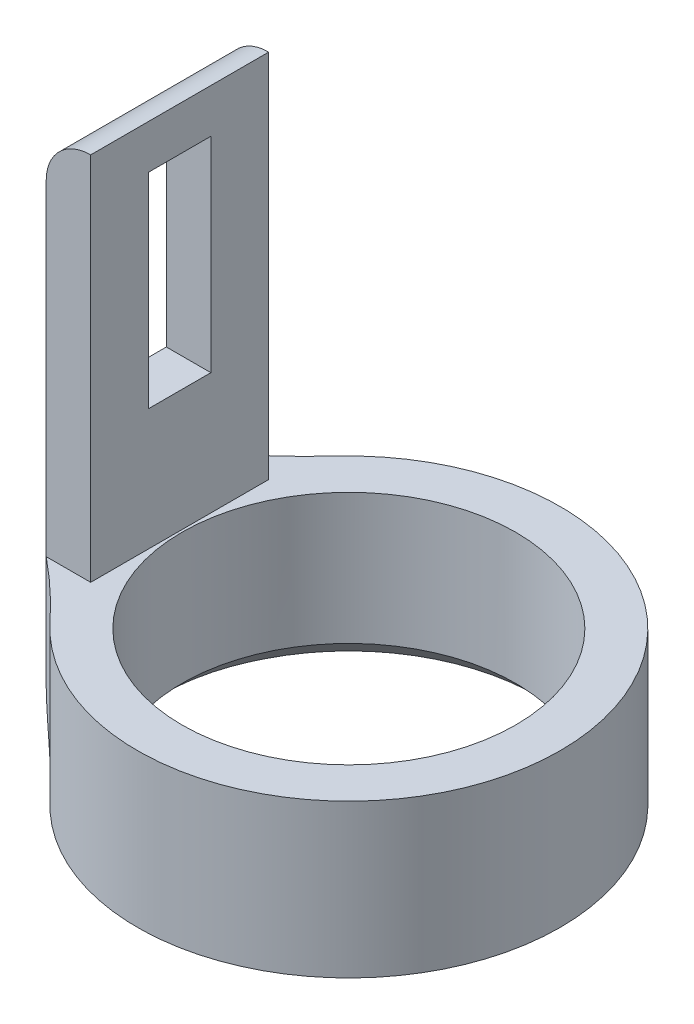
from build123d import *

# Parameters (mm, degrees)
SKETCH2_R           = 4.75
SKETCH2_R_2         = 3.75
BOSS_EXTRUDE1_DEPTH = 3.44
SKETCH3_W           = 4
SKETCH3_H           = 11.757601451
BOSS_EXTRUDE2_DEPTH = 1
SKETCH4_W           = 1.4
SKETCH4_H           = 4.6
CUT_EXTRUDE1_DEPTH  = 1
FILLET1_R           = 13
CHAMFER1_SIZE       = 0.5
FILLET2_R           = 1


with BuildPart() as part:
    # Sketch2 → Boss-Extrude1 (new body)
    with BuildSketch(Plane(origin=(0, 0, 0), x_dir=(1, 0, 0), z_dir=(0, 1, 0))):
        with Locations(Location((0, 0, 0), (0, 0, 270))):
            Circle(SKETCH2_R)
        with Locations(Location((0, 0, 0), (0, 0, 270))):
            Circle(SKETCH2_R_2, mode=Mode.SUBTRACT)
    extrude(amount=BOSS_EXTRUDE1_DEPTH)

    # Sketch3 → Boss-Extrude2 (add)
    with BuildSketch(Plane(origin=(-4.8, 0, 0), x_dir=(0, 0, -1), z_dir=(1, 0, 0))):
        with Locations((0, 5.878800726)):
            Rectangle(SKETCH3_W, SKETCH3_H)
    extrude(amount=BOSS_EXTRUDE2_DEPTH)

    # Sketch4 → Cut-Extrude1 (cut)
    with BuildSketch(Plane.ZY.offset(4.8)):
        with Locations((0, 8.46916965)):
            Rectangle(SKETCH4_W, SKETCH4_H)
    extrude(amount=-CUT_EXTRUDE1_DEPTH, mode=Mode.SUBTRACT)

    # Fillet1
    # the kernel refuses this fillet: 13 mm, written as the material it adds along each edge
    with BuildSketch(Plane(origin=(-4.308421985, 3.44, 2), x_dir=(0.5581025465687688, 0, 0.8297719852546573), z_dir=(0, -1, 0))) as fillet1_piece_1:
        with BuildLine():
            CenterArc((3.528934631, 12.839109145), FILLET1_R, 252.988692503, 7.987692365)
            Line((-0.274350942, 0.407897665), (-0.350416654, 0.159273436))
            ThreePointArc((-0.350416654, 0.159273436), (-0.352916187, 0.058842171), (-0.215740716, -0.145106662))
            Line((-0.215740716, -0.145106662), (0.0407788, -0.256782183))
            ThreePointArc((0.0407788, -0.256782183), (0.744997311, -0.201212957), (1.449215822, -0.256782183))
            Line((1.449215822, -0.256782183), (1.489994622, 0))
        make_face()
    extrude(amount=3.44)
    with BuildSketch(Plane(origin=(-4.308421985, 3.44, -2), x_dir=(0.5581025465687675, 0, -0.8297719852546583), z_dir=(0, -1, 0))) as fillet1_piece_2:
        with BuildLine():
            CenterArc((3.528934631, -12.839109145), FILLET1_R, 99.023615132, 7.987692365)
            Line((-0.274350942, -0.407897665), (-0.350416654, -0.159273436))
            ThreePointArc((-0.350416654, -0.159273436), (-0.352916187, -0.058842171), (-0.215740716, 0.145106662))
            Line((-0.215740716, 0.145106662), (0.0407788, 0.256782183))
            ThreePointArc((0.0407788, 0.256782183), (0.744997311, 0.201212957), (1.449215822, 0.256782183))
            Line((1.449215822, 0.256782183), (1.489994622, 0))
        make_face()
    extrude(amount=3.44)

    # Chamfer1
    chamfer1_edges = [part.edges().sort_by_distance(p)[0] for p in [
        (0, 0, -3.75),
    ]]
    chamfer(chamfer1_edges, length=CHAMFER1_SIZE)

    # Fillet2
    # the kernel refuses this fillet: 1 mm, written as the material it takes off along each edge
    with BuildSketch(Plane(origin=(-4.8, 0, 4.5), x_dir=(1, 0, 0), z_dir=(0, 0, -1))) as fillet2_piece_1:
        with BuildLine():
            CenterArc((FILLET2_R, -FILLET2_R), FILLET2_R, 90, 90)
            Line((0, -FILLET2_R), (0, 0))
            Line((0, 0), (FILLET2_R, 0))
        make_face()
    extrude(amount=9, mode=Mode.SUBTRACT)
    with BuildSketch(Plane(origin=(-4.8, 11.757601451, -4.5), x_dir=(0, -1, 0), z_dir=(0, 0, 1))) as fillet2_piece_2:
        with BuildLine():
            CenterArc((FILLET2_R, FILLET2_R), FILLET2_R, 180, 90)
            Line((0, FILLET2_R), (0, 0))
            Line((0, 0), (FILLET2_R, 0))
        make_face()
    extrude(amount=9, mode=Mode.SUBTRACT)


solid = part.part
